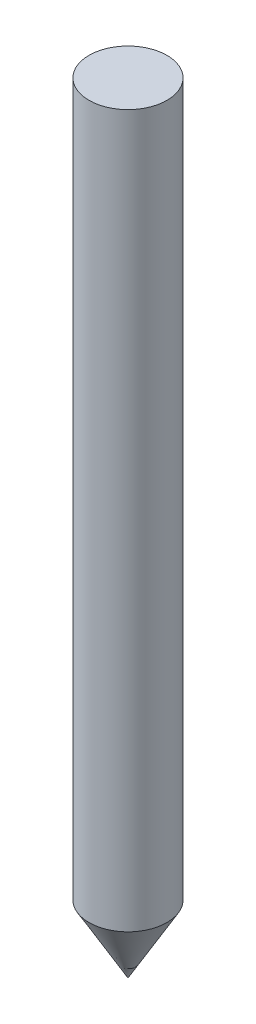
from build123d import *

# Parameters (mm, degrees)
SKETCH1_R           = 6
BOSS_EXTRUDE1_DEPTH = 120
CHAMFER1_SIZE2      = 6
CHAMFER1_SIZE       = 10.392304845


with BuildPart() as part:
    # Sketch1 → Boss-Extrude1 (new body)
    with BuildSketch(Plane(origin=(0, 0, 0), x_dir=(1, 0, 0), z_dir=(0, 1, 0))):
        with Locations(Location((0, 0, 0), (0, 0, 270))):
            Circle(SKETCH1_R)
    extrude(amount=BOSS_EXTRUDE1_DEPTH)

    # Chamfer1
    chamfer1_edges = [part.edges().sort_by_distance(p)[0] for p in [
        (0, 0, -6),
    ]]
    chamfer1_side = [part.faces().sort_by_distance(p)[0] for p in [
        (0, 0.12, -6),
    ]]
    chamfer(chamfer1_edges, length=CHAMFER1_SIZE - 0.0001, length2=CHAMFER1_SIZE2 - 0.0001, reference=chamfer1_side[0])  # a hair under: the kernel refuses the full size


solid = part.part
